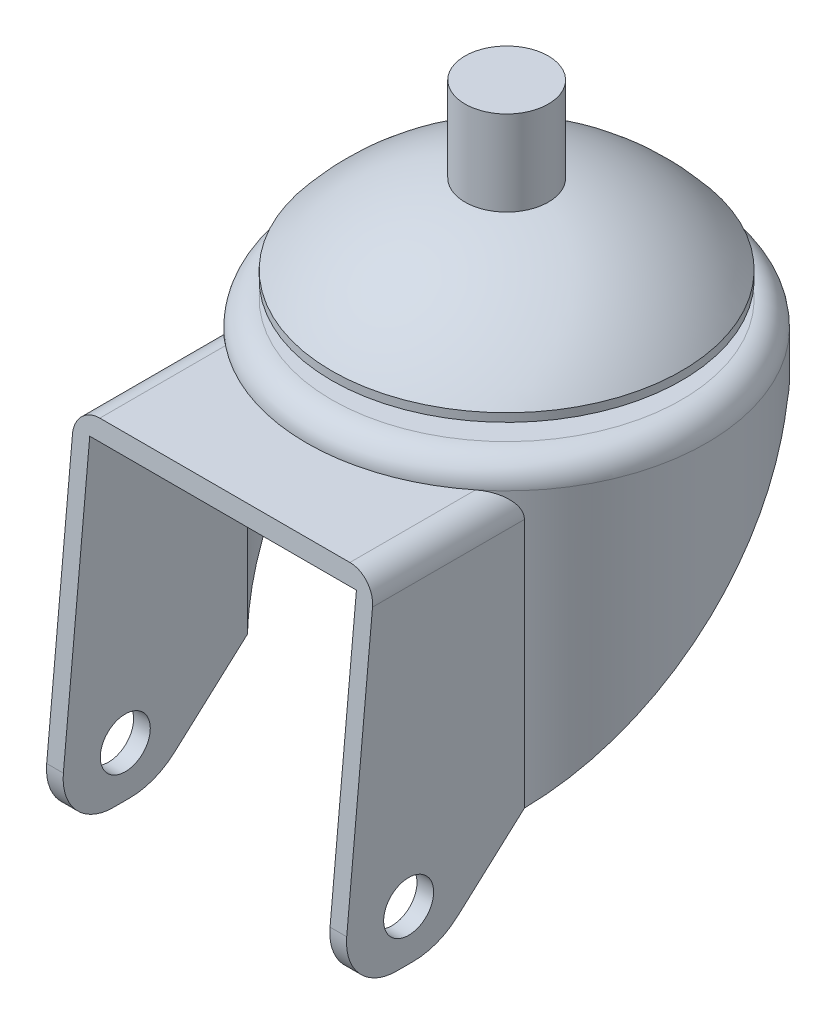
from build123d import *

# Parameters (mm, degrees)
SKETCH1_R                = 24
BOSS_EXTRUDE1_DEPTH      = 42
FILLET1_R                = 3
BOSS_EXTRUDE2_DEPTH      = 18
BOSS_EXTRUDE2_DEPTH_BACK = 18
CUT_EXTRUDE2_DEPTH       = 42
CUT_EXTRUDE3_DEPTH       = 62.400856059
CUT_EXTRUDE3_DEPTH_BACK  = 62.400856059
FILLET2_R                = 6
FILLET3_R                = 8
FILLET4_R                = 3
SKETCH6_W                = 32
SKETCH6_H                = 1.990473873
SKETCH6_H_2              = 40.942974084
CUT_EXTRUDE5_DEPTH       = 40
SKETCH7_R                = 16
BOSS_EXTRUDE3_DEPTH      = 1
SKETCH8_R                = 10
CUT_EXTRUDE6_DEPTH       = 3
CHAMFER1_SIZE            = 3
SKETCH9_R                = 5
BOSS_EXTRUDE4_DEPTH      = 4
CHAMFER2_SIZE            = 1
SKETCH10_R               = 3
CUT_EXTRUDE7_DEPTH       = 71.095779947
SKETCH11_R               = 7.5
BOSS_EXTRUDE5_DEPTH      = 2
SKETCH12_R               = 21
BOSS_EXTRUDE6_DEPTH      = 1
DOME1_FACE_RADIUS        = 21
DOME1_HEIGHT             = 10
BOSS_EXTRUDE7_START      = -30
SKETCH13_R               = 5
BOSS_EXTRUDE7_DEPTH      = 30
SCALE1_SCALE             = 0.7761


# Some blends are built 0.0001 mm under size
with BuildPart() as part:
    # Sketch1 → Boss-Extrude1 (new body)
    with BuildSketch(Plane(origin=(0, 0, 0), x_dir=(1, 0, 0), z_dir=(0, 1, 0))):
        with Locations(Location((0, 0, 0), (0, 0, 90))):
            Circle(SKETCH1_R)
    extrude(amount=BOSS_EXTRUDE1_DEPTH)

    # Fillet1
    fillet1_edges = [part.edges().sort_by_distance(p)[0] for p in [
        (0, 42, 24),
    ]]
    fillet(fillet1_edges, radius=FILLET1_R)

    # Sketch2 → Boss-Extrude2 (add, two sides: drawn at the far end of the back side and taken through both)
    with BuildSketch(Plane(origin=(0, 0, 0), x_dir=(0, 0, -1), z_dir=(1, 0, 0)).offset(-BOSS_EXTRUDE2_DEPTH_BACK)):
        Polygon((-24, 39), (-33.81365361, 39), (-37.816201771, -3.269008091), (-26.156604955, -3.269008091), (15.957162651, 34.668187521), (24, 34.668187521), (24, 39), align=None)
    extrude(amount=BOSS_EXTRUDE2_DEPTH + BOSS_EXTRUDE2_DEPTH_BACK)

    # Sketch4 → Cut-Extrude2 (cut)
    with BuildSketch(Plane.XZ):
        with BuildLine():
            Line((23.002581612, -9.203628547), (22.165135271, -9.203628547))
            ThreePointArc((22.165135271, -9.203628547), (0, -24), (-22.165135271, -9.203628547))
            Line((-22.165135271, -9.203628547), (-22.165135271, -25.095490922))
            Line((-22.165135271, -25.095490922), (23.002581612, -25.095490922))
            Line((23.002581612, -25.095490922), (23.002581612, -9.203628547))
        make_face()
    extrude(amount=-CUT_EXTRUDE2_DEPTH, mode=Mode.SUBTRACT)

    # Sketch5 → Cut-Extrude3 (cut, two sides: drawn at the far end of the back side and taken through both)
    with BuildSketch(Plane(origin=(0, 0, 0), x_dir=(0, 0, -1), z_dir=(1, 0, 0)).offset(-CUT_EXTRUDE3_DEPTH_BACK)):
        Polygon((-26.156604955, -3.269008091), (14.621999629, 33.5), (25.781931598, 33.5), (25.781931598, -3.269008091), align=None)
    extrude(amount=CUT_EXTRUDE3_DEPTH + CUT_EXTRUDE3_DEPTH_BACK, mode=Mode.SUBTRACT)

    # Fillet2
    fillet2_edges = [part.edges().sort_by_distance(p)[0] for p in [
        (0, -3.269008091, 37.816201771),
    ]]
    fillet(fillet2_edges, radius=FILLET2_R)

    # Fillet3
    fillet3_edges = [part.edges().sort_by_distance(p)[0] for p in [
        (0, -3.269008091, 26.156604955),
    ]]
    fillet(fillet3_edges, radius=FILLET3_R)

    # Fillet4
    # the kernel refuses this fillet: 3 mm, written as the material it takes off along each edge
    with BuildSketch(Plane(origin=(18, 39, 41.31365361), x_dir=(-1, 0, 0), z_dir=(0, 0, -1))) as fillet4_piece_1_section:
        with BuildLine():
            CenterArc((FILLET4_R, -FILLET4_R), FILLET4_R, 90, 90)
            Line((0, -FILLET4_R), (0, 0))
            Line((0, 0), (FILLET4_R, 0))
        make_face()
    fillet4_piece_1 = extrude(amount=32.939145744, mode=Mode.PRIVATE)
    fillet4_piece_1 = fillet4_piece_1 - Plane(origin=(0, 38.317129028, 0), x_dir=(0, 0, -1), z_dir=(0, -1, 0)) * Cylinder(24, 78, mode=Mode.PRIVATE)
    add(fillet4_piece_1, mode=Mode.SUBTRACT)
    with BuildSketch(Plane(origin=(-18, 39, 8.374507866), x_dir=(0, -1, 0), z_dir=(0, 0, 1))) as fillet4_piece_2_section:
        with BuildLine():
            CenterArc((FILLET4_R, FILLET4_R), FILLET4_R, 180, 90)
            Line((0, FILLET4_R), (0, 0))
            Line((0, 0), (FILLET4_R, 0))
        make_face()
    fillet4_piece_2 = extrude(amount=32.939145744, mode=Mode.PRIVATE)
    fillet4_piece_2 = fillet4_piece_2 - Plane(origin=(0, 38.317126887, 0), x_dir=(0, 0, -1), z_dir=(0, -1, 0)) * Cylinder(24, 78, mode=Mode.PRIVATE)
    add(fillet4_piece_2, mode=Mode.SUBTRACT)

    # Sketch6 → Cut-Extrude5 (cut)
    with BuildSketch(Plane.XZ.offset(3.269008091)):
        with BuildLine():
            ThreePointArc((16, 15.099668871), (0, 22), (-16, 15.099668871))
            Line((-16, 15.099668871), (-16, 2.278234246))
            Line((-16, 2.278234246), (16, 2.278234246))
            Line((16, 2.278234246), (16, 15.099668871))
        make_face()
        with BuildLine():
            Line((-16, 2.278234246), (-16, 15.099668871))
            ThreePointArc((-16, 15.099668871), (-8.124038405, -20.4450483), (22, 0))
            ThreePointArc((22, 0), (20.4450483, 8.124038405), (16, 15.099668871))
            Line((16, 15.099668871), (16, 2.278234246))
            Line((16, 2.278234246), (-16, 2.278234246))
        make_face()
        with Locations((0, 30.225971395)):
            Rectangle(SKETCH6_W, SKETCH6_H)
        with Locations((0, 51.692695373)):
            Rectangle(SKETCH6_W, SKETCH6_H_2)
        with BuildLine():
            Line((16, 29.230734458), (-16, 29.230734458))
            Line((-16, 29.230734458), (-16, 15.099668871))
            ThreePointArc((-16, 15.099668871), (0, 22), (16, 15.099668871))
            Line((16, 15.099668871), (16, 29.230734458))
        make_face()
    extrude(amount=-CUT_EXTRUDE5_DEPTH, mode=Mode.SUBTRACT)

    # Sketch7 → Boss-Extrude3 (add)
    with BuildSketch(Plane.XZ.offset(-36.730991909)):
        with Locations(Location((0, 0, 0), (0, 0, 270))):
            Circle(SKETCH7_R)
    extrude(amount=BOSS_EXTRUDE3_DEPTH)

    # Sketch8 → Cut-Extrude6 (cut)
    with BuildSketch(Plane.XZ.offset(-35.730991909)):
        with Locations(Location((0, 0, 0), (0, 0, 270))):
            Circle(SKETCH8_R)
    extrude(amount=-CUT_EXTRUDE6_DEPTH, mode=Mode.SUBTRACT)

    # Chamfer1
    chamfer1_edges = [part.edges().sort_by_distance(p)[0] for p in [
        (0, 38.730991909, 10),
    ]]
    chamfer(chamfer1_edges, length=CHAMFER1_SIZE - 0.0001)  # a hair under: the kernel refuses the full size

    # Sketch9 → Boss-Extrude4 (add)
    with BuildSketch(Plane.XZ.offset(-38.730991909)):
        with Locations(Location((0, 0, 0), (0, 0, 270))):
            Circle(SKETCH9_R)
    extrude(amount=BOSS_EXTRUDE4_DEPTH)

    # Chamfer2
    chamfer2_edges = [part.edges().sort_by_distance(p)[0] for p in [
        (0, 34.730991909, 5),
    ]]
    chamfer(chamfer2_edges, length=CHAMFER2_SIZE)

    # Sketch10 → Cut-Extrude7 (cut, through all)
    with BuildSketch(Plane(origin=(18, 0, 0), x_dir=(0, 0, -1), z_dir=(1, 0, 0))):
        with Locations((-29.763213514, 2.730991909)):
            Circle(SKETCH10_R)
    extrude(amount=-CUT_EXTRUDE7_DEPTH, mode=Mode.SUBTRACT)

    # Sketch11 → Boss-Extrude5 (add)
    with BuildSketch(Plane(origin=(0, 42, 0), x_dir=(1, 0, 0), z_dir=(0, 1, 0))):
        with Locations(Location((0, 0, 0), (0, 0, 270))):
            Circle(SKETCH11_R)
    extrude(amount=BOSS_EXTRUDE5_DEPTH)

    # Sketch12 → Boss-Extrude6 (add)
    with BuildSketch(Plane(origin=(0, 44, 0), x_dir=(1, 0, 0), z_dir=(0, 1, 0))):
        with Locations(Location((0, 0, 0), (0, 0, 270))):
            Circle(SKETCH12_R)
    extrude(amount=BOSS_EXTRUDE6_DEPTH)

    # Dome1: a dome of height H over a round flat face of radius A is a cap of a sphere of radius (A * A + H * H) / (2 * H)
    dome1_r = (DOME1_FACE_RADIUS * DOME1_FACE_RADIUS + DOME1_HEIGHT * DOME1_HEIGHT) / (2 * DOME1_HEIGHT)
    dome1_base = Plane((0, 45, 0), z_dir=(0, 1, 0))
    with Locations(dome1_base.offset(DOME1_HEIGHT - dome1_r)):
        dome1_ball = Sphere(dome1_r, mode=Mode.PRIVATE)
    add(split(dome1_ball, bisect_by=dome1_base, keep=Keep.TOP, mode=Mode.PRIVATE))

    # Sketch13 → Boss-Extrude7 (add)
    with BuildSketch(Plane.XZ.offset(-34.730991909).offset(BOSS_EXTRUDE7_START)):
        with Locations(Location((0, 0, 0), (0, 0, 270))):
            Circle(SKETCH13_R)
    extrude(amount=BOSS_EXTRUDE7_DEPTH)


with BuildPart() as part_1:
    # Scale1: scaled about (-4.3e-08, 39.220241586, 4.118564184)
    add(part.part.scale(SCALE1_SCALE).moved(Location((-1e-08, 8.781412091, 0.922146521))))


solid = part_1.part
